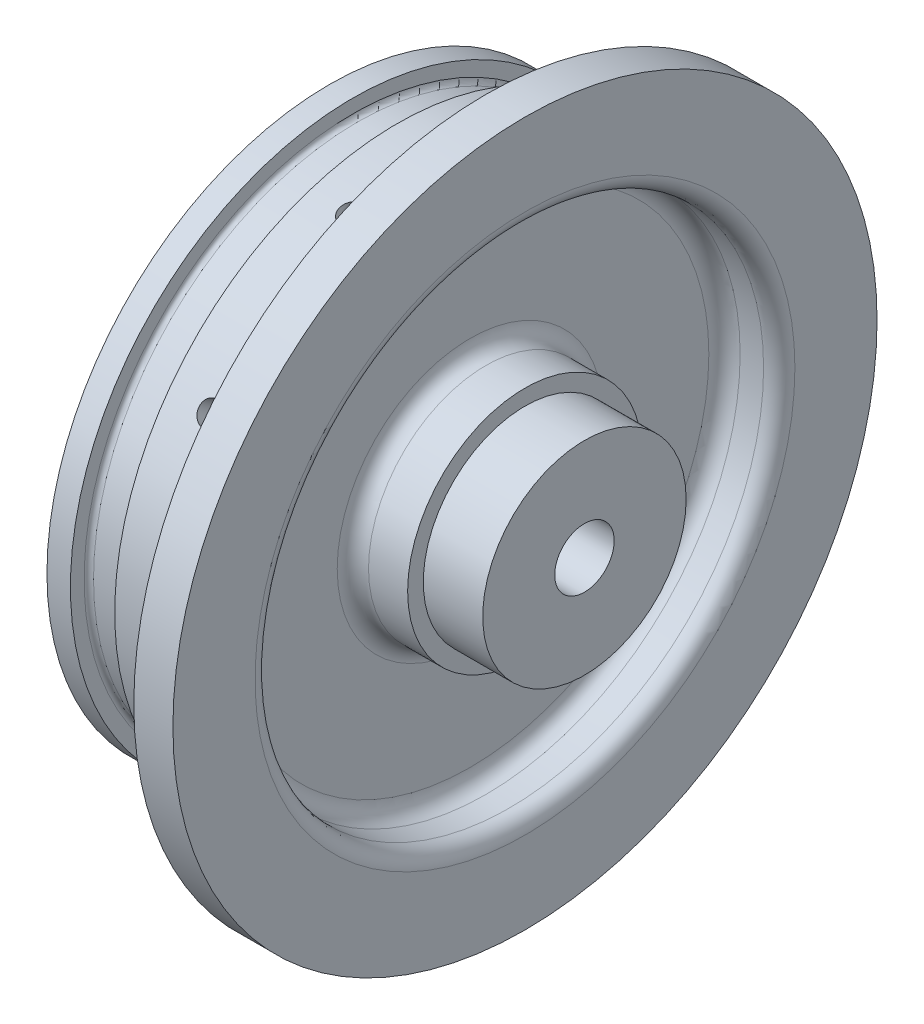
from build123d import *

# Parameters (mm, degrees)
SKETCH1_R           = 57.15
BOSS_EXTRUDE1_DEPTH = 6.35
SKETCH2_R           = 45.847
BOSS_EXTRUDE2_DEPTH = 25.4
SKETCH11_R          = 1.89865
CUT_EXTRUDE3_DEPTH  = 10.16
CIRPATTERN1_COUNT   = 10
SKETCH15_R          = 4.826
CUT_EXTRUDE4_DEPTH  = 87.83494404
BOSS_EXTRUDE3_START = 9.652
SKETCH17_R          = 16.51
SKETCH17_R_2        = 4.826
BOSS_EXTRUDE3_DEPTH = 9.652
SKETCH18_W          = 8.89
SKETCH18_H          = 22.225
FILLET1_R           = 2.54


with BuildPart() as part:
    # Sketch1 → Boss-Extrude1 (new body)
    with BuildSketch(Plane(origin=(0, 0, 0), x_dir=(0, 0, -1), z_dir=(1, 0, 0))):
        Circle(SKETCH1_R)
    extrude(amount=BOSS_EXTRUDE1_DEPTH)

    # Sketch2 → Boss-Extrude2 (add)
    with BuildSketch(Plane.ZY):
        Circle(SKETCH2_R)
    extrude(amount=BOSS_EXTRUDE2_DEPTH)

    # Sketch11 → Cut-Extrude3 (cut)
    with BuildSketch(Plane(origin=(0, 0, -45.847), x_dir=(-1, 0, 0), z_dir=(0, 0, -1))):
        with Locations((7.62, 0)):
            Circle(SKETCH11_R)
    cut_extrude3 = extrude(amount=-CUT_EXTRUDE3_DEPTH, mode=Mode.SUBTRACT)

    # CirPattern1: Cut-Extrude3 ×10 about axis
    cirpattern1_axis = Axis((0, 0, 0), (-1, 0, 0))
    for i in range(1, CIRPATTERN1_COUNT):
        add(cut_extrude3.rotate(cirpattern1_axis, i * 360 / CIRPATTERN1_COUNT), mode=Mode.SUBTRACT)

    # Sketch15 → Cut-Extrude4 (cut, through all)
    with BuildSketch(Plane(origin=(6.35, 0, 0), x_dir=(0, 0, -1), z_dir=(1, 0, 0))):
        Circle(SKETCH15_R)
    extrude(amount=-CUT_EXTRUDE4_DEPTH, mode=Mode.SUBTRACT)

    # Sketch16 → Cut-Revolve1 (revolve, cut)
    with BuildSketch(Plane.XY):
        with BuildLine():
            Line((-21.59, 45.847), (-14.4018, 45.847))
            Line((-14.4018, 45.847), (-14.4018, 43.6245))
            ThreePointArc((-14.4018, 43.6245), (-14.624984633, 43.085684633), (-15.1638, 42.8625))
            Line((-15.1638, 42.8625), (-20.828, 42.8625))
            ThreePointArc((-20.828, 42.8625), (-21.366815367, 43.085684633), (-21.59, 43.6245))
            Line((-21.59, 43.6245), (-21.59, 45.847))
        make_face()
    revolve(axis=Axis((0, 0, 0), (-1, 0, 0)), mode=Mode.SUBTRACT)

    # Sketch17 → Boss-Extrude3 (add)
    with BuildSketch(Plane(origin=(6.35, 0, 0), x_dir=(0, 0, -1), z_dir=(1, 0, 0)).offset(BOSS_EXTRUDE3_START)):
        Circle(SKETCH17_R)
        Circle(SKETCH17_R_2, mode=Mode.SUBTRACT)
    extrude(amount=-BOSS_EXTRUDE3_DEPTH)

    # Sketch18 → Cut-Revolve2 (revolve, cut)
    with BuildSketch(Plane.XY):
        with Locations((1.905, 30.1625)):
            Rectangle(SKETCH18_W, SKETCH18_H)
    revolve(axis=Axis((0, 0, 0), (-1, 0, 0)), mode=Mode.SUBTRACT)

    # Fillet1
    fillet1_edges = [part.edges().sort_by_distance(p)[0] for p in [
        (6.35, -41.275, 0),
        (-2.54, -41.275, 0),
        (-2.54, -19.05, 0),
    ]]
    fillet(fillet1_edges, radius=FILLET1_R)


solid = part.part
